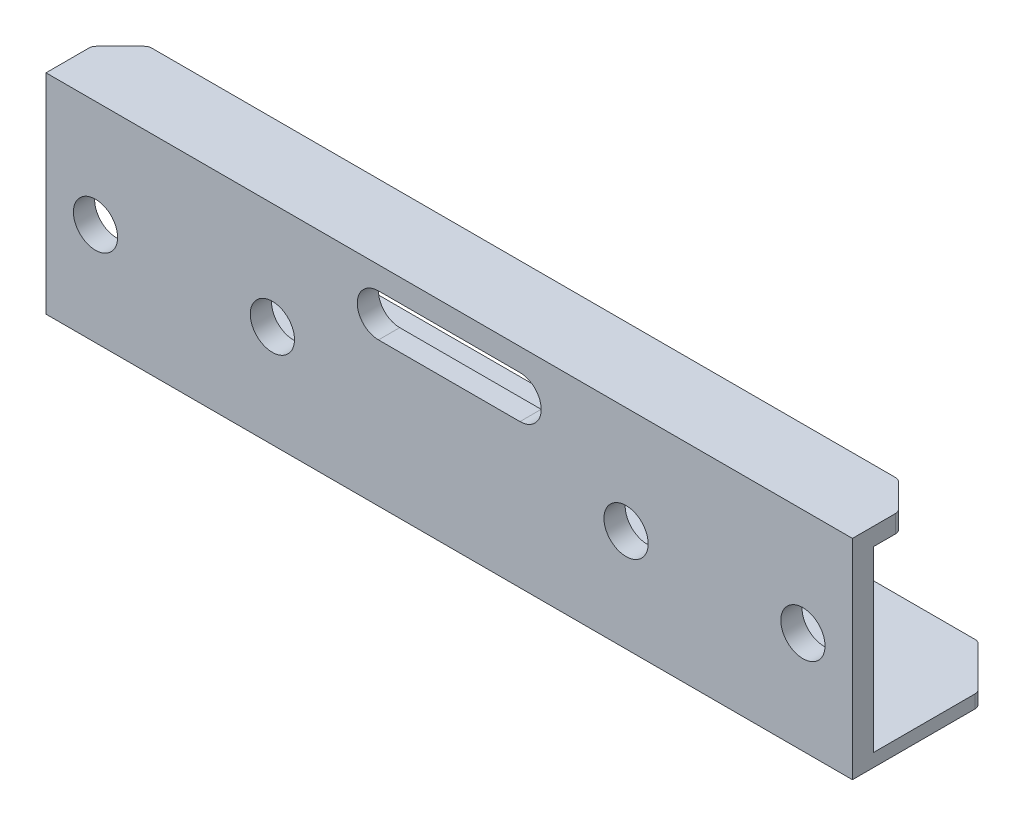
from build123d import *

# Parameters (mm, degrees)
SKETCH1_R            = 3.125
BOSS_EXTRUDE1_DEPTH  = 2.5
BOSS_EXTRUDE2_START  = -2.5
SKETCH2_W            = 114
SKETCH2_H            = 2.5
BOSS_EXTRUDE2_DEPTH  = 6
SKETCH2_6_W          = 114
SKETCH2_6_H          = 2
BOSS_EXTRUDE3_DEPTH  = 10
SKETCH5_W            = 53
SKETCH5_H            = 15
SKETCH5_R            = 1.03775
BOSS_EXTRUDE4_DEPTH  = 2.5
CHAMFER1_SIZE        = 6.25
CHAMFER2_SIZE        = 4
FILLET2_R            = 1
FILLET3_R            = 4
CUT_EXTRUDE2_DEPTH   = 171.104117862
MOVE_START           = 2.5
MOVE_FACE1_OUTLINE_W = 114
MOVE_FACE1_OUTLINE_H = 30.7
MOVE_FACE1_OUTLINE_R = 3.125
MOVE_FACE1_DEPTH     = 0.5
MOVE_FACE2_BY        = 1
MOVE_FACE3_BY        = 0.5
MOVE_FACE4_BY        = 0.65


# Read off the part's stored shape, not the designer's step: Move Face1
with BuildPart() as part:
    # Sketch1 → Boss-Extrude1 (new body)
    with BuildSketch(Plane.XY):
        Polygon((52.096119502, 0), (52.096119502, 25.2), (52.096119502, 28.2), (166.096119502, 28.2), (166.096119502, 25.2), (166.096119502, 0), (166.096119502, -2.5), (52.096119502, -2.5), align=None)
        with Locations((84.096119502, 12.6)):
            Circle(SKETCH1_R, mode=Mode.SUBTRACT)
        with Locations((134.096119502, 12.6)):
            Circle(SKETCH1_R, mode=Mode.SUBTRACT)
        with Locations((59.096119502, 12.6)):
            Circle(SKETCH1_R, mode=Mode.SUBTRACT)
        with Locations((159.096119502, 12.6)):
            Circle(SKETCH1_R, mode=Mode.SUBTRACT)
    extrude(amount=BOSS_EXTRUDE1_DEPTH)

    # Sketch2 → Boss-Extrude2 (add)
    with BuildSketch(Plane.XY.offset(2.5).offset(BOSS_EXTRUDE2_START)):
        with Locations((109.096119502, -1.25)):
            Rectangle(SKETCH2_W, SKETCH2_H)
    extrude(amount=-BOSS_EXTRUDE2_DEPTH)

    # Sketch2<6> → Boss-Extrude3 (add)
    with BuildSketch(Plane.XY.offset(2.5)):
        with Locations((109.096119502, 27.2)):
            Rectangle(SKETCH2_6_W, SKETCH2_6_H)
    extrude(amount=-BOSS_EXTRUDE3_DEPTH)

    # Sketch5 → Boss-Extrude4 (add)
    with BuildSketch(Plane.XZ.offset(2.5)):
        with Locations((139.596119502, -13.5)):
            Rectangle(SKETCH5_W, SKETCH5_H)
        with Locations((146.088533212, -17.095733919)):
            Circle(SKETCH5_R, mode=Mode.SUBTRACT)
        with Locations((132.088533212, -17.095733919)):
            Circle(SKETCH5_R, mode=Mode.SUBTRACT)
    boss_extrude4 = extrude(amount=-BOSS_EXTRUDE4_DEPTH)

    # Mirror1: Boss-Extrude4 across plane
    add(boss_extrude4.mirror(Plane(origin=(109.096119502, 0, 0), x_dir=(0, 0, 1), z_dir=(1, 0, 0))))

    # Chamfer1
    chamfer1_edges = [part.edges().sort_by_distance(p)[0] for p in [
        (166.096119502, -1.25, -21),
        (113.096119502, -1.25, -21),
        (52.096119502, -1.25, -21),
        (105.096119502, -1.25, -21),
    ]]
    chamfer(chamfer1_edges, length=CHAMFER1_SIZE)

    # Chamfer2
    chamfer2_edges = [part.edges().sort_by_distance(p)[0] for p in [
        (52.096119502, 27.2, -7.5),
        (166.096119502, 27.2, -7.5),
    ]]
    chamfer(chamfer2_edges, length=CHAMFER2_SIZE)

    # Fillet2
    fillet2_edges = [part.edges().sort_by_distance(p)[0] for p in [
        (98.846119502, -1.25, -21),
        (105.096119502, -1.25, -14.75),
        (113.096119502, -1.25, -14.75),
        (159.846119502, -1.25, -21),
        (119.346119502, -1.25, -21),
        (166.096119502, -1.25, -14.75),
        (166.096119502, 27.2, -3.5),
        (56.096119502, 27.2, -7.5),
        (162.096119502, 27.2, -7.5),
        (52.096119502, 27.2, -3.5),
        (52.096119502, -1.25, -14.75),
    ]]
    fillet(fillet2_edges, radius=FILLET2_R)

    # Fillet3
    fillet3_edges = [part.edges().sort_by_distance(p)[0] for p in [
        (113.096119502, -1.25, -6),
        (105.096119502, -1.25, -6),
    ]]
    fillet(fillet3_edges, radius=FILLET3_R - 0.0001)  # a hair under: the kernel refuses the full size

    # Sketch6 → Cut-Extrude2 (cut, through all)
    with BuildSketch(Plane.XY.offset(2.5)):
        with BuildLine():
            Line((119.096119502, 24.5), (99.096119502, 24.5))
            ThreePointArc((99.096119502, 24.5), (96.096119502, 21.5), (99.096119502, 18.5))
            Line((99.096119502, 18.5), (119.096119502, 18.5))
            ThreePointArc((119.096119502, 18.5), (122.096119502, 21.5), (119.096119502, 24.5))
        make_face()
    extrude(amount=-CUT_EXTRUDE2_DEPTH, mode=Mode.SUBTRACT)

    # Move Face1 outline → Move Face1 (add)
    with BuildSketch(Plane.XY.offset(MOVE_START)):
        with Locations((109.096119502, 12.85)):
            Rectangle(MOVE_FACE1_OUTLINE_W, MOVE_FACE1_OUTLINE_H)
        with Locations((59.096119502, 12.6)):
            Circle(MOVE_FACE1_OUTLINE_R, mode=Mode.SUBTRACT)
        with Locations((84.096119502, 12.6)):
            Circle(MOVE_FACE1_OUTLINE_R, mode=Mode.SUBTRACT)
        with Locations((134.096119502, 12.6)):
            Circle(MOVE_FACE1_OUTLINE_R, mode=Mode.SUBTRACT)
        with Locations((159.096119502, 12.6)):
            Circle(MOVE_FACE1_OUTLINE_R, mode=Mode.SUBTRACT)
        with BuildLine():
            Line((99.096119502, 24.5), (119.096119502, 24.5))
            ThreePointArc((119.096119502, 24.5), (122.096119502, 21.5), (119.096119502, 18.5))
            Line((119.096119502, 18.5), (99.096119502, 18.5))
            ThreePointArc((99.096119502, 18.5), (96.096119502, 21.5), (99.096119502, 24.5))
        make_face(mode=Mode.SUBTRACT)
    extrude(amount=MOVE_FACE1_DEPTH)

    # Move Face2: a face moved outward by 1.0
    extrude(part.faces().sort_by_distance((109.096119502, 26.2, -3.703733506))[0], amount=MOVE_FACE2_BY, dir=(0, -1, 0))

    # Move Face3: a face moved inward by 0.5
    extrude(part.faces().sort_by_distance((109.096119502, 28.2, -2.196700016))[0], amount=MOVE_FACE3_BY, dir=(0, -1, 0), mode=Mode.SUBTRACT)

    # Move Face4: a face moved inward by 0.65
    extrude(part.faces().sort_by_distance((109.096119502, -2.5, -3))[0], amount=MOVE_FACE4_BY, dir=(0, 1, 0), mode=Mode.SUBTRACT)


solid = part.part
